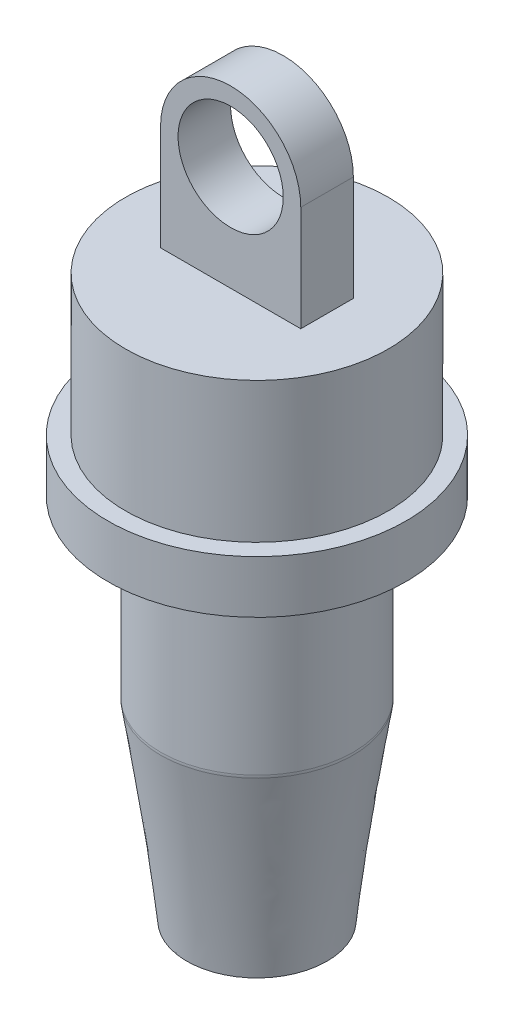
from build123d import *

# Parameters (mm, degrees)
ESBO_O1_R                  = 7.5
RESSALTO_EXTRUS_O1_DEPTH   = 8
ESBO_O2_R                  = 8.5
RESSALTO_EXTRUS_O2_DEPTH   = 3
ESBO_O3_W                  = 8
ESBO_O3_H                  = 3
RESSALTO_EXTRUS_O3_DEPTH   = 10
CORTE_EXTRUS_O1_DEPTH      = 23.27666941
CORTE_EXTRUS_O1_DEPTH_BACK = 23.27666941
ESBO_O5_R                  = 3
CORTE_EXTRUS_O2_DEPTH      = 3
ESBO_O6_R                  = 5.5
RESSALTO_EXTRUS_O4_DEPTH   = 10
FILETE1_R                  = 1
SKETCH1_R                  = 1.75
CUT_EXTRUDE1_DEPTH         = 10


with BuildPart() as part:
    # Esboço1 → Ressalto-extrusão1 (new body)
    with BuildSketch(Plane(origin=(0, 0, 0), x_dir=(1, 0, 0), z_dir=(0, 1, 0))):
        with Locations(Location((0, 0, 0), (0, 0, 270))):
            Circle(ESBO_O1_R)
    extrude(amount=RESSALTO_EXTRUS_O1_DEPTH)

    # Esboço2 → Ressalto-extrusão2 (add)
    with BuildSketch(Plane.XZ):
        with Locations(Location((0, 0, 0), (0, 0, 270))):
            Circle(ESBO_O2_R)
    extrude(amount=RESSALTO_EXTRUS_O2_DEPTH)

    # Esboço3 → Ressalto-extrusão3 (add)
    with BuildSketch(Plane(origin=(0, 8, 0), x_dir=(1, 0, 0), z_dir=(0, 1, 0))):
        Rectangle(ESBO_O3_W, ESBO_O3_H)
    extrude(amount=RESSALTO_EXTRUS_O3_DEPTH)

    # Esboço4 → Corte-extrusão1 (cut, two sides: drawn at the far end of the back side and taken through both)
    with BuildSketch(Plane.XY.offset(1.5).offset(-CORTE_EXTRUS_O1_DEPTH_BACK)):
        with BuildLine():
            Line((-4, 18), (-4, 13.999999871))
            ThreePointArc((-4, 13.999999871), (-2.828427176, 16.828427073), (-1.7e-08, 18))
            Line((-1.7e-08, 18), (-4, 18))
        make_face()
        with BuildLine():
            Line((4, 18), (-1.7e-08, 18))
            ThreePointArc((-1.7e-08, 18), (2.828427119, 16.828427131), (4, 14))
            Line((4, 14), (4, 18))
        make_face()
    extrude(amount=CORTE_EXTRUS_O1_DEPTH + CORTE_EXTRUS_O1_DEPTH_BACK, mode=Mode.SUBTRACT)

    # Esboço5 → Corte-extrusão2 (cut)
    with BuildSketch(Plane.XY.offset(1.5)):
        with Locations((0, 14)):
            Circle(ESBO_O5_R)
    extrude(amount=-CORTE_EXTRUS_O2_DEPTH, mode=Mode.SUBTRACT)

    # Esboço6 → Ressalto-extrusão4 (add)
    with BuildSketch(Plane.XZ.offset(3)):
        with Locations(Location((0, 0, 0), (0, 0, 270))):
            Circle(ESBO_O6_R)
    extrude(amount=RESSALTO_EXTRUS_O4_DEPTH)

    # Loft1: read off the stored shape, not the designer's step
    # Loft1: loft between two sections, ruled curve by curve
    loft1_from = [
        Edge.make_bspline([(1.054348973, -13, 5.397994835), (-9.741640698, -13, 7.506692781), (-11.850338644, -13, -3.28929689), (-1.054348973, -13, -5.397994835), (9.741640698, -13, -7.506692781), (11.850338644, -13, 3.28929689), (1.054348973, -13, 5.397994835)], [0, 0, 0, 0, 0.5, 0.5, 0.5, 1, 1, 1, 1], 3, [1, 0.333333333, 0.333333333, 1, 0.333333333, 0.333333333, 1]),
    ]
    loft1_to = [
        Edge.make_bspline([(-0.660465845, -24, 3.945096307), (-8.550658458, -24, 2.624164617), (-7.229726768, -24, -5.266027996), (0.660465845, -24, -3.945096307), (8.550658458, -24, -2.624164617), (7.229726768, -24, 5.266027996), (-0.660465845, -24, 3.945096307)], [0, 0, 0, 0, 0.5, 0.5, 0.5, 1, 1, 1, 1], 3, [1, 0.333333333, 0.333333333, 1, 0.333333333, 0.333333333, 1]),
    ]
    loft1 = Solid(Shell([*[Face.make_surface_from_curves(loft1_from[k], loft1_to[k]) for k in range(1)], Face(Wire(loft1_from)), Face(Wire(loft1_to))]))
    add(loft1)

    # Filete1
    filete1_edges = [part.edges().sort_by_distance(p)[0] for p in [
        (-5.474439314, -13, 0.529635915),
    ]]
    fillet(filete1_edges, radius=FILETE1_R)

    # Sketch1 → Cut-Extrude1 (cut)
    with BuildSketch(Plane.XZ.offset(24)):
        with Locations(Location((0, 0, 0), (0, 0, 270))):
            Circle(SKETCH1_R)
    extrude(amount=-CUT_EXTRUDE1_DEPTH, mode=Mode.SUBTRACT)


solid = part.part
